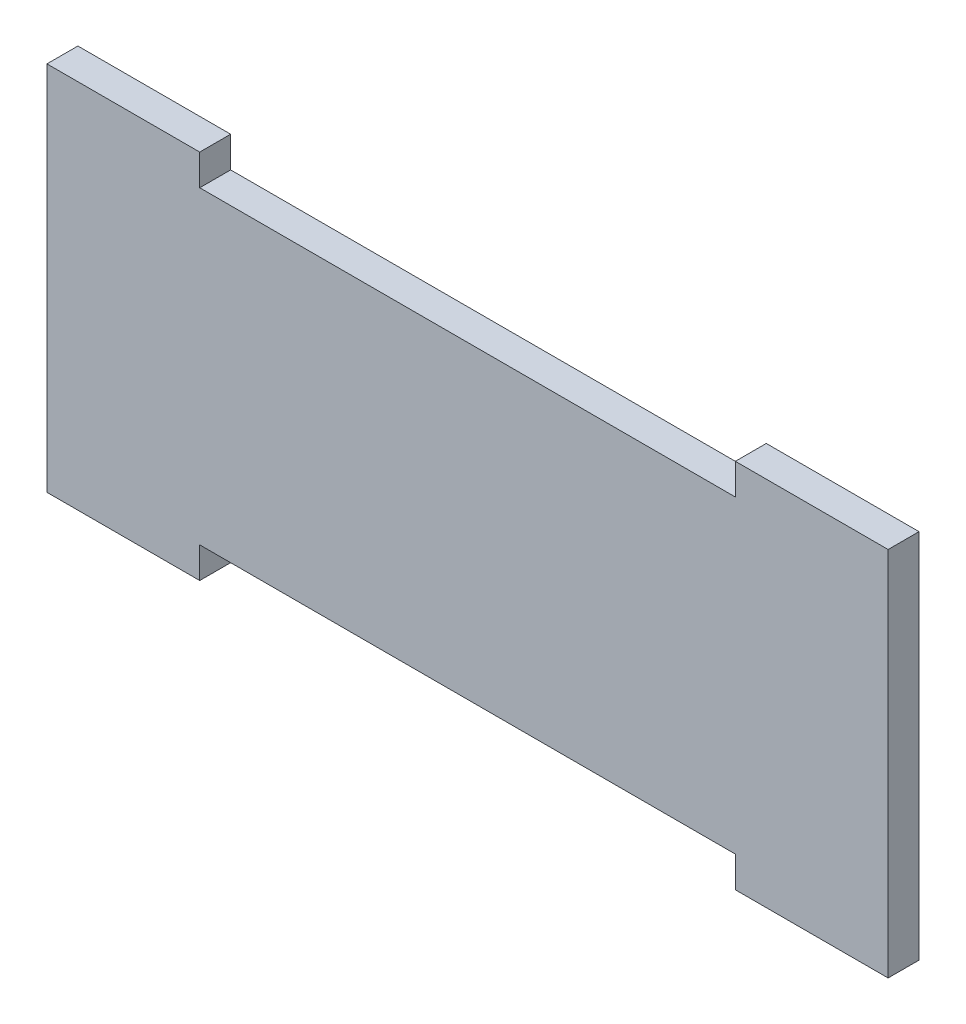
from build123d import *

# Parameters (mm, degrees)
SKETCH1_W           = 136
SKETCH1_H           = 50
BOSS_EXTRUDE1_DEPTH = 5
SKETCH2_W           = 24.7
SKETCH2_H           = 5
BOSS_EXTRUDE2_DEPTH = 5
SKETCH3_W           = 24.7
SKETCH3_H           = 5
BOSS_EXTRUDE3_DEPTH = 5


with BuildPart() as part:
    # Sketch1 → Boss-Extrude1 (new body)
    with BuildSketch(Plane.XY):
        with Locations((0, 25)):
            Rectangle(SKETCH1_W, SKETCH1_H)
    extrude(amount=BOSS_EXTRUDE1_DEPTH)

    # Sketch2 → Boss-Extrude2 (add)
    with BuildSketch(Plane(origin=(0, 50, 0), x_dir=(1, 0, 0), z_dir=(0, 1, 0))):
        with Locations((-55.65, -2.5)):
            Rectangle(SKETCH2_W, SKETCH2_H)
        with Locations((55.65, -2.5)):
            Rectangle(SKETCH2_W, SKETCH2_H)
    extrude(amount=BOSS_EXTRUDE2_DEPTH)

    # Sketch3 → Boss-Extrude3 (add)
    with BuildSketch(Plane.XZ):
        with Locations((-55.65, 2.5)):
            Rectangle(SKETCH3_W, SKETCH3_H)
        with Locations((55.65, 2.5)):
            Rectangle(SKETCH3_W, SKETCH3_H)
    extrude(amount=BOSS_EXTRUDE3_DEPTH)


solid = part.part
